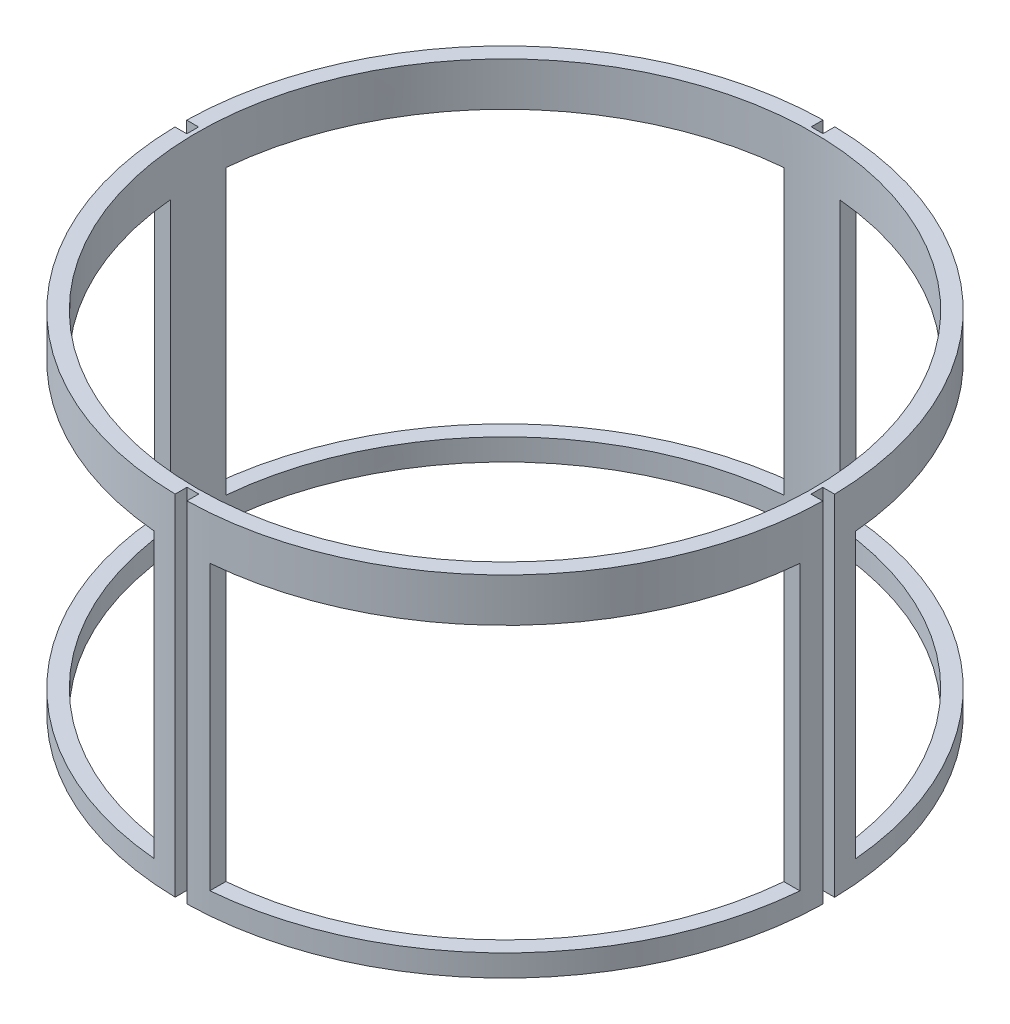
from build123d import *

# Parameters (mm, degrees)
SKETCH1_R           = 94.2975
SKETCH1_R_2         = 89.662
BOSS_EXTRUDE1_DEPTH = 101.6
SKETCH5_W           = 3.429
SKETCH5_H           = 5.08
SKETCH5_W_2         = 5.08
SKETCH5_H_2         = 3.429
CUT_EXTRUDE1_DEPTH  = 101.6
CUT_EXTRUDE2_START  = -12.7
CUT_EXTRUDE2_DEPTH  = 82.55
CIRPATTERN1_COUNT   = 4


with BuildPart() as part:
    # Sketch1 → Boss-Extrude1 (new body)
    with BuildSketch(Plane(origin=(0, 0, 0), x_dir=(1, 0, 0), z_dir=(0, 1, 0))):
        Circle(SKETCH1_R)
        Circle(SKETCH1_R_2, mode=Mode.SUBTRACT)
    extrude(amount=-BOSS_EXTRUDE1_DEPTH)

    # Sketch5 → Cut-Extrude1 (cut)
    with BuildSketch(Plane(origin=(0, 0, 0), x_dir=(1, 0, 0), z_dir=(0, 1, 0))):
        with Locations((0, 93.360875)):
            Rectangle(SKETCH5_W, SKETCH5_H)
        with Locations((0, -93.360875)):
            Rectangle(SKETCH5_W, SKETCH5_H)
        with Locations((-93.360875, -0.0635)):
            Rectangle(SKETCH5_W_2, SKETCH5_H_2)
        with Locations((93.360875, -0.0635)):
            Rectangle(SKETCH5_W_2, SKETCH5_H_2)
    extrude(amount=-CUT_EXTRUDE1_DEPTH, mode=Mode.SUBTRACT)

    # Sketch7 → Cut-Extrude2 (cut)
    with BuildSketch(Plane(origin=(0, 0, 0), x_dir=(1, 0, 0), z_dir=(0, 1, 0)).offset(CUT_EXTRUDE2_START)):
        with BuildLine():
            Line((89.292832075, -8.128), (93.946549283, -8.128))
            ThreePointArc((93.946549283, -8.128), (66.655864041, -66.700931742), (8.0645, -93.952021511))
            Line((8.0645, -93.952021511), (8.0645, -89.298589484))
            ThreePointArc((8.0645, -89.298589484), (63.378061476, -63.423146938), (89.292832075, -8.128))
        make_face()
    cut_extrude2 = extrude(amount=-CUT_EXTRUDE2_DEPTH, mode=Mode.SUBTRACT)

    # CirPattern1: Cut-Extrude2 ×4 about axis
    cirpattern1_axis = Axis((0, 0, 0), (0, 1, 0))
    for i in range(1, CIRPATTERN1_COUNT):
        add(cut_extrude2.rotate(cirpattern1_axis, i * 360 / CIRPATTERN1_COUNT), mode=Mode.SUBTRACT)


solid = part.part
